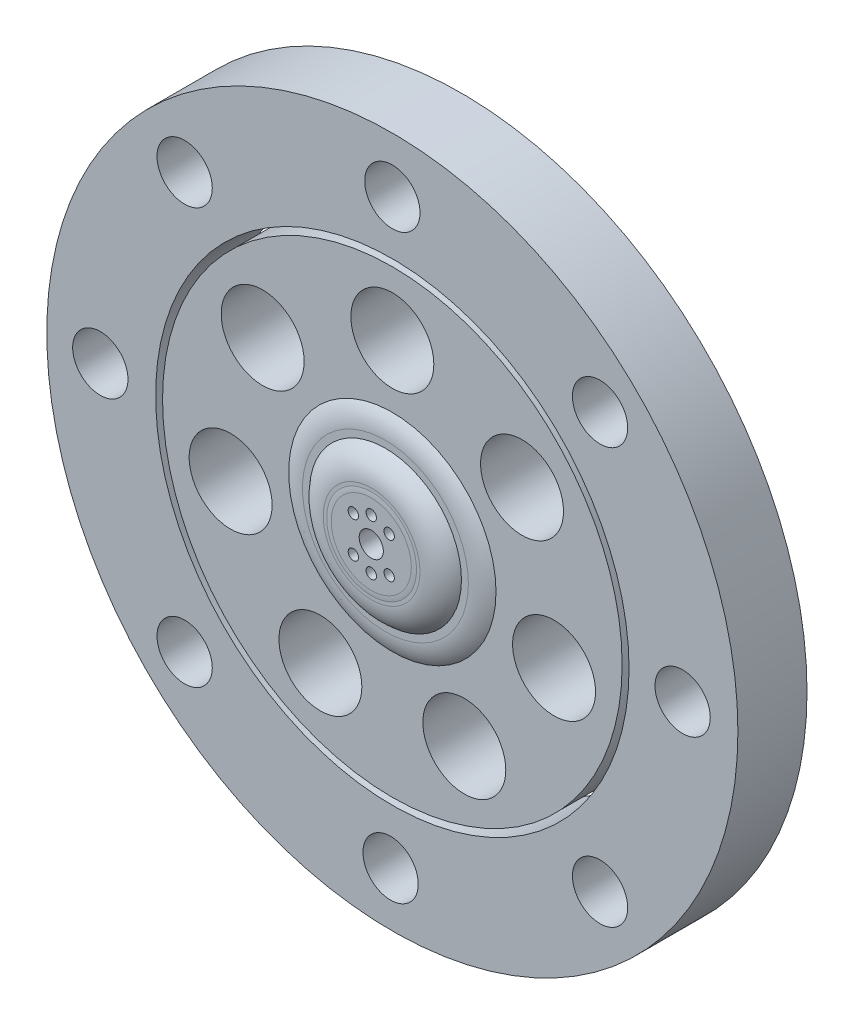
from build123d import *

# Parameters (mm, degrees)
BOSS_EXTRUDE1_DEPTH      = 10
BOSS_EXTRUDE1_DEPTH_BACK = 10
SKETCH1_R                = 100
SKETCH1_R_2              = 8
SKETCH4_R                = 30
BOSS_EXTRUDE2_DEPTH      = 12
SKETCH5_R                = 22
BOSS_EXTRUDE3_DEPTH      = 4
SKETCH6_R                = 13
BOSS_EXTRUDE4_DEPTH      = 0.1
SKETCH2_R                = 68.5
SKETCH2_R_2              = 66.5
CUT_EXTRUDE11_DEPTH      = 66
SKETCH7_R                = 12
CUT_EXTRUDE12_DEPTH      = 31
SKETCH9_R                = 8
CUT_EXTRUDE13_DEPTH      = 31
SKETCH10_R               = 1.5
SKETCH10_R_2             = 3.5
CUT_EXTRUDE14_DEPTH      = 31
FILLET5_R                = 10
SKETCH11_R               = 66.5
SKETCH11_R_2             = 63.5
EXTRUDE_THIN2_DEPTH      = 28
SKETCH11_R_3             = 26.5
SKETCH11_R_4             = 23.5
EXTRUDE_THIN2_2_DEPTH    = 28


with BuildPart() as part:
    # Sketch1 → Boss-Extrude1 (new, two sides: drawn at the far end of the back side and taken through both)
    with BuildSketch(Plane.XY.offset(-BOSS_EXTRUDE1_DEPTH_BACK)):
        Circle(SKETCH1_R)
        with Locations((0, 84)):
            Circle(SKETCH1_R_2, mode=Mode.SUBTRACT)
        with Locations((84, -0.507247964)):
            Circle(SKETCH1_R_2, mode=Mode.SUBTRACT)
        with Locations((-0.507247964, -84.507247964)):
            Circle(SKETCH1_R_2, mode=Mode.SUBTRACT)
        with Locations((-84.507247964, 0)):
            Circle(SKETCH1_R_2, mode=Mode.SUBTRACT)
    extrude(amount=BOSS_EXTRUDE1_DEPTH + BOSS_EXTRUDE1_DEPTH_BACK)

    # Sketch4 → Boss-Extrude2 (add)
    with BuildSketch(Plane.XY):
        Circle(SKETCH4_R)
    extrude(amount=BOSS_EXTRUDE2_DEPTH)

    # Sketch5 → Boss-Extrude3 (add)
    with BuildSketch(Plane.XY.offset(12)):
        Circle(SKETCH5_R)
    extrude(amount=BOSS_EXTRUDE3_DEPTH)

    # Sketch6 → Boss-Extrude4 (add)
    with BuildSketch(Plane.XY.offset(16)):
        Circle(SKETCH6_R)
    extrude(amount=BOSS_EXTRUDE4_DEPTH)

    # Sketch2 → Cut-Extrude11 (cut, symmetric)
    with BuildSketch(Plane.XY):
        Circle(SKETCH2_R)
        Circle(SKETCH2_R_2, mode=Mode.SUBTRACT)
    extrude(amount=CUT_EXTRUDE11_DEPTH, both=True, mode=Mode.SUBTRACT)


with BuildPart() as cut_extrude11_piece_1:
    # of the separate pieces the step leaves, piece 1, a body of its own (cut_extrude11_pieces)
    add(part.part.solids().sort_by_distance((100, 0, 0))[0])

    # Sketch9 → Cut-Extrude13 (cut, symmetric)
    with BuildSketch(Plane.XY.offset(10)):
        with Locations((-60.104076401, 60.104076401)):
            Circle(SKETCH9_R)
        with Locations((60.104076401, 60.104076401)):
            Circle(SKETCH9_R)
        with Locations((60.104076401, -60.104076401)):
            Circle(SKETCH9_R)
        with Locations((-60.104076401, -60.104076401)):
            Circle(SKETCH9_R)
    extrude(amount=CUT_EXTRUDE13_DEPTH, both=True, mode=Mode.SUBTRACT)


with BuildPart() as cut_extrude11_piece_2:
    # of the separate pieces the step leaves, piece 2, a body of its own (cut_extrude11_pieces)
    add(part.part.solids().sort_by_distance((66.5, 0, 10))[0])

    # Sketch7 → Cut-Extrude12 (cut, symmetric)
    with BuildSketch(Plane.XY.offset(10)):
        with Locations((0, 48)):
            Circle(SKETCH7_R)
        with Locations((37.527911158, 29.927510489)):
            Circle(SKETCH7_R)
        with Locations((46.796539785, -10.68100483)):
            Circle(SKETCH7_R)
        with Locations((20.826419478, -43.246505659)):
            Circle(SKETCH7_R)
        with Locations((-20.826419478, -43.246505659)):
            Circle(SKETCH7_R)
        with Locations((-46.796539785, -10.68100483)):
            Circle(SKETCH7_R)
        with Locations((-37.527911158, 29.927510489)):
            Circle(SKETCH7_R)
    extrude(amount=CUT_EXTRUDE12_DEPTH, both=True, mode=Mode.SUBTRACT)

    # Sketch10 → Cut-Extrude14 (cut, symmetric)
    with BuildSketch(Plane.XY.offset(16.1)):
        with Locations((0, 7.296037155)):
            Circle(SKETCH10_R)
        with Locations((0, -7.296037155)):
            Circle(SKETCH10_R)
        with Locations((-5.18978461, 5.177728197)):
            Circle(SKETCH10_R)
        with Locations((5.177728197, 5.18978461)):
            Circle(SKETCH10_R)
        with Locations((5.18978461, -5.177728197)):
            Circle(SKETCH10_R)
        with Locations((-5.177728197, -5.18978461)):
            Circle(SKETCH10_R)
        Circle(SKETCH10_R_2)
    extrude(amount=CUT_EXTRUDE14_DEPTH, both=True, mode=Mode.SUBTRACT)

    # Fillet5
    # the kernel refuses this fillet: 10 mm, written as the material it takes off along each edge
    with BuildSketch(Plane(origin=(0, 0, 12), x_dir=(1, 0, 0), z_dir=(0, -1, 0))) as fillet5_piece_1:
        with BuildLine():
            CenterArc((24, -10), FILLET5_R, 53.130102354, 36.869897646)
            Line((24, 0), (30, 0))
            Line((30, 0), (30, -2))
        make_face()
    revolve(axis=Axis((0, 0, 12), (0, 0, 1)), mode=Mode.SUBTRACT)
    with BuildSketch(Plane(origin=(0, 0, 16), x_dir=(1, 0, 0), z_dir=(0, -1, 0))) as fillet5_piece_2:
        with BuildLine():
            CenterArc((14, -10), FILLET5_R, 36.869897646, 53.130102354)
            Line((14, 0), (22, 0))
            Line((22, 0), (22, -4))
        make_face()
    revolve(axis=Axis((0, 0, 16), (0, 0, 1)), mode=Mode.SUBTRACT)
    with BuildSketch(Plane(origin=(0, 0, 16.1), x_dir=(1, 0, 0), z_dir=(0, -1, 0))) as fillet5_piece_3:
        with BuildLine():
            CenterArc((11.589326402, -10), FILLET5_R, 81.890385544, 8.109614456)
            Line((13, -0.1), (13, 0))
            Line((13, 0), (11.589326402, 0))
        make_face()
    revolve(axis=Axis((0, 0, 16.1), (0, 0, 1)), mode=Mode.SUBTRACT)


with BuildPart() as body_3:
    # Sketch11 → Extrude-Thin2 (new body)
    with BuildSketch(Plane.XY):
        Circle(SKETCH11_R)
        Circle(SKETCH11_R_2, mode=Mode.SUBTRACT)
    extrude(amount=-EXTRUDE_THIN2_DEPTH)


with BuildPart() as body_4:
    # Sketch11 → Extrude-Thin2 2 (new body)
    with BuildSketch(Plane.XY):
        Circle(SKETCH11_R_3)
        Circle(SKETCH11_R_4, mode=Mode.SUBTRACT)
    extrude(amount=-EXTRUDE_THIN2_2_DEPTH)


solid = Compound([cut_extrude11_piece_1.part, cut_extrude11_piece_2.part, body_3.part, body_4.part])
